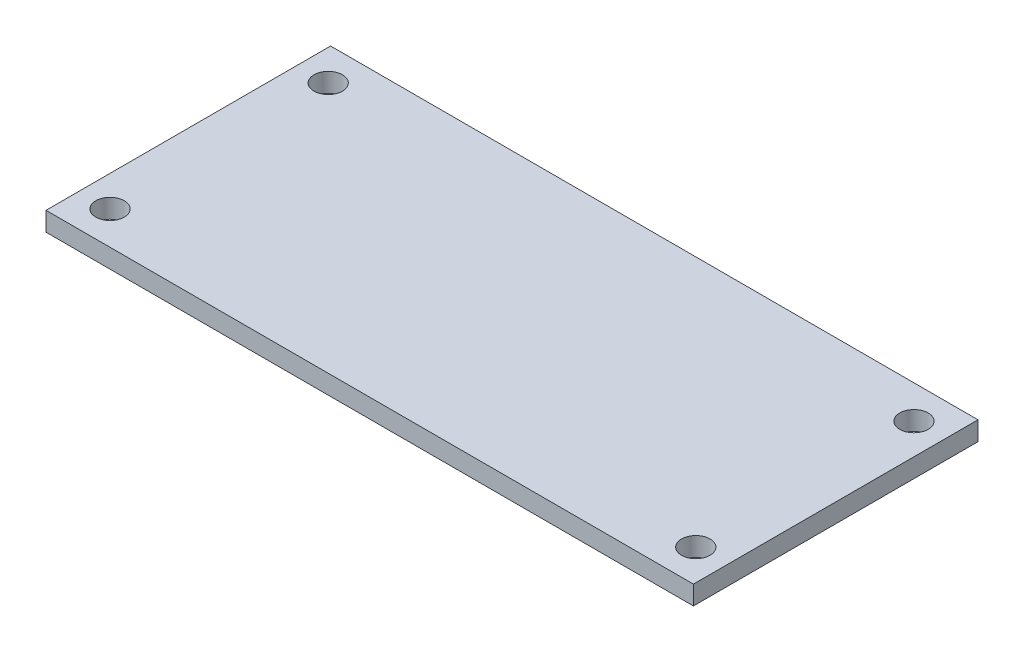
from build123d import *

# Parameters (mm, degrees)
SKETCH1_W           = 68.25
SKETCH1_H           = 30
SKETCH1_R           = 1.5
BOSS_EXTRUDE1_DEPTH = 2


with BuildPart() as part:
    # Sketch1 → Boss-Extrude1 (new body)
    with BuildSketch(Plane(origin=(0, 0, 0), x_dir=(1, 0, 0), z_dir=(0, 1, 0))):
        with Locations((34.125, 15)):
            Rectangle(SKETCH1_W, SKETCH1_H)
        with Locations((3.25, 3.5)):
            Circle(SKETCH1_R, mode=Mode.SUBTRACT)
        with Locations((65, 3.5)):
            Circle(SKETCH1_R, mode=Mode.SUBTRACT)
        with Locations((3.25, 26.5)):
            Circle(SKETCH1_R, mode=Mode.SUBTRACT)
        with Locations((65, 26.5)):
            Circle(SKETCH1_R, mode=Mode.SUBTRACT)
    extrude(amount=BOSS_EXTRUDE1_DEPTH)


solid = part.part
